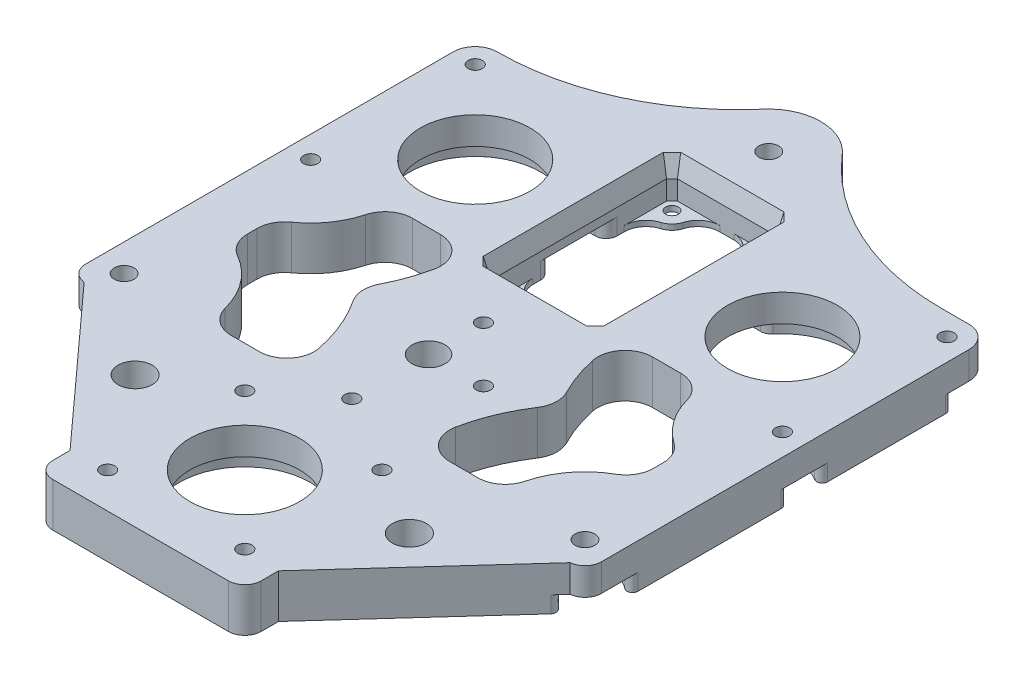
from build123d import *

# Parameters (mm, degrees)
BOSS_EXTRUDE1_DEPTH                             = 5
FILLET1_R                                       = 4
SKETCH22_W                                      = 28
SKETCH22_H                                      = 5
CUT_EXTRUDE3_DEPTH                              = 34
CSK_FOR_M3_FLAT_HEAD_MACHINE_SCREW1_D           = 3.6
CSK_FOR_M3_FLAT_HEAD_MACHINE_SCREW1_CSINK_D     = 6.3
CSK_FOR_M3_FLAT_HEAD_MACHINE_SCREW1_CSINK_ANGLE = 90
FILLET4_R                                       = 3
CHAMFER3_DEPTH                                  = 5
CSK_FOR_M2_FLAT_HEAD_MACHINE_SCREW2_D           = 2.6
CSK_FOR_M2_FLAT_HEAD_MACHINE_SCREW2_CSINK_D     = 4.4
CSK_FOR_M2_FLAT_HEAD_MACHINE_SCREW2_CSINK_ANGLE = 90
CUT_EXTRUDE4_DEPTH                              = 87.546230421
CUT_EXTRUDE4_DEPTH_BACK                         = 87.546230421
SKETCH25_R                                      = 1.3
SKETCH25_R_2                                    = 3
CHAMFER1_SIZE                                   = 0.9
SKETCH27_R                                      = 10
CUT_EXTRUDE9_DEPTH                              = 10
SKETCH29_R                                      = 3.1
CUT_EXTRUDE11_DEPTH                             = 87.546230421
SKETCH33_R                                      = 2.395679076
CUT_EXTRUDE14_DEPTH                             = 10
CUT_EXTRUDE15_DEPTH                             = 10
BOSS_EXTRUDE2_START                             = 3
SKETCH36_R                                      = 5.15
SKETCH36_R_2                                    = 12
SKETCH36_R_3                                    = 4.2
SKETCH36_R_4                                    = 3
SKETCH36_R_5                                    = 5.1
SKETCH36_R_6                                    = 2.2
BOSS_EXTRUDE2_DEPTH                             = 3
SKETCH37_R                                      = 1.15
BOSS_EXTRUDE3_DEPTH                             = 1
FILLET5_R                                       = 44
FILLET6_R                                       = 4
SKETCH39_R                                      = 4.2
CUT_EXTRUDE16_DEPTH                             = 3
FILLET7_START                                   = -4
FILLET7_DEPTH                                   = 4
CUT_EXTRUDE17_DEPTH                             = 87.771250999
SKETCH41_W                                      = 13.805283352
SKETCH41_H                                      = 10
CUT_EXTRUDE18_DEPTH                             = 3
FILLET8_R                                       = 5
FILLET9_R                                       = 2
CHAMFER5_SIZE                                   = 1
CHAMFER5_SIZE2                                  = 3.487414444


with BuildPart() as part:
    # Sketch1 → Boss-Extrude1 (new body)
    with BuildSketch(Plane(origin=(0, 0, 0), x_dir=(1, 0, 0), z_dir=(0, 1, 0))):
        with BuildLine():
            Line((47, -54), (-47, -54))
            Line((-47, -54), (-47, 54))
            Line((-47, 54), (-5.541381265, 54))
            ThreePointArc((-5.541381265, 54), (-2.5, 72.5), (0.541381265, 54))
            Line((0.541381265, 54), (10.891256717, 54))
            Line((10.891256717, 54), (47, 54))
            Line((47, 54), (47, -54))
        make_face()
    extrude(amount=BOSS_EXTRUDE1_DEPTH)

    # Fillet1
    fillet1_edges = [part.edges().sort_by_distance(p)[0] for p in [
        (47, 2.5, 54),
        (-47, 2.5, 54),
        (-47, 2.5, -54),
        (47, 2.5, -54),
    ]]
    fillet(fillet1_edges, radius=FILLET1_R)

    # Sketch22 → Cut-Extrude3 (cut)
    with BuildSketch(Plane.XY.offset(54)):
        with Locations((-33, 2.5)):
            Rectangle(SKETCH22_W, SKETCH22_H)
        with Locations((33, 2.5)):
            Rectangle(SKETCH22_W, SKETCH22_H)
    extrude(amount=-CUT_EXTRUDE3_DEPTH, mode=Mode.SUBTRACT)

    # CSK for M3 Flat Head Machine Screw1 (through all)
    with Locations(Plane(origin=(0, 0, 0), x_dir=(-1, 0, 0), z_dir=(0, -1, 0))):
        with Locations((-42, -49), (2.5, 63), (42, -49), (-42, -15), (42, -15)):
            CounterSinkHole(CSK_FOR_M3_FLAT_HEAD_MACHINE_SCREW1_D / 2, CSK_FOR_M3_FLAT_HEAD_MACHINE_SCREW1_CSINK_D / 2, counter_sink_angle=CSK_FOR_M3_FLAT_HEAD_MACHINE_SCREW1_CSINK_ANGLE)

    # Fillet4
    fillet4_edges = [part.edges().sort_by_distance(p)[0] for p in [
        (-47, 2.5, 20),
        (-19, 2.5, 54),
        (47, 2.5, 20),
        (19, 2.5, 54),
    ]]
    fillet(fillet4_edges, radius=FILLET4_R)

    # Chamfer3: read off the stored shape, not the designer's step
    # Chamfer3 outline → Chamfer3 (add)
    with BuildSketch(Plane(origin=(0, 0, 0), x_dir=(1, 0, 0), z_dir=(0, 1, 0))):
        with BuildLine():
            Line((19, -20), (19, -47.854497241))
            Line((19, -47.854497241), (44.290322581, -19.985919088))
            ThreePointArc((44.290322581, -19.985919088), (44.145331925, -19.996477704), (44, -20))
            Line((44, -20), (19, -20))
        make_face()
        with BuildLine():
            ThreePointArc((-44, -20), (-44.145331925, -19.996477704), (-44.290322581, -19.985919088))
            Line((-44.290322581, -19.985919088), (-19, -47.854497241))
            Line((-19, -47.854497241), (-19, -20))
            Line((-19, -20), (-44, -20))
        make_face()
    extrude(amount=CHAMFER3_DEPTH)

    # CSK for M2 Flat Head Machine Screw2 (through all)
    with Locations(Plane(origin=(0, 0, 0), x_dir=(-1, 0, 0), z_dir=(0, -1, 0))):
        with Locations((12.5, -47.5), (-12.5, -47.5), (12.5, -22.5), (-12.5, -22.5), (-43, 50), (-43, 20), (43, 50), (43, 20)):
            CounterSinkHole(CSK_FOR_M2_FLAT_HEAD_MACHINE_SCREW2_D / 2, CSK_FOR_M2_FLAT_HEAD_MACHINE_SCREW2_CSINK_D / 2, counter_sink_angle=CSK_FOR_M2_FLAT_HEAD_MACHINE_SCREW2_CSINK_ANGLE)

    # Sketch25 → Cut-Extrude4 (cut, two sides: drawn at the far end of the back side and taken through both)
    with BuildSketch(Plane(origin=(0, 0, 0), x_dir=(1, 0, 0), z_dir=(0, 1, 0)).offset(-CUT_EXTRUDE4_DEPTH_BACK)):
        with Locations(Location((-1.5, 10, 0), (0, 0, 270))):
            Circle(SKETCH25_R)
        with Locations(Location((8.5, 0, 0), (0, 0, 270))):
            Circle(SKETCH25_R)
        with Locations(Location((-1.5, -14, 0), (0, 0, 270))):
            Circle(SKETCH25_R)
        with Locations(Location((-1.5, 0, 0), (0, 0, 270))):
            Circle(SKETCH25_R_2)
    extrude(amount=CUT_EXTRUDE4_DEPTH + CUT_EXTRUDE4_DEPTH_BACK, mode=Mode.SUBTRACT)

    # Chamfer1
    chamfer1_edges = [part.edges().sort_by_distance(p)[0] for p in [
        (-1.5, 0, -11.3),
        (8.5, 0, -1.3),
        (-1.5, 0, 12.7),
    ]]
    chamfer(chamfer1_edges, length=CHAMFER1_SIZE)

    # Sketch27 → Cut-Extrude9 (cut)
    with BuildSketch(Plane(origin=(0, 5, 0), x_dir=(1, 0, 0), z_dir=(0, 1, 0))):
        with Locations(Location((-28, 35, 0), (0, 0, 270))):
            Circle(SKETCH27_R)
        with Locations(Location((28, 35, 0), (0, 0, 270))):
            Circle(SKETCH27_R)
        with Locations(Location((0, -35, 0), (0, 0, 270))):
            Circle(SKETCH27_R)
    extrude(amount=-CUT_EXTRUDE9_DEPTH, mode=Mode.SUBTRACT)

    # Sketch29 → Cut-Extrude11 (cut, through all)
    with BuildSketch(Plane(origin=(0, 5, 0), x_dir=(1, 0, 0), z_dir=(0, 1, 0))):
        with Locations(Location((-25, -30, 0), (0, 0, 270))):
            Circle(SKETCH29_R)
        with Locations(Location((25, -30, 0), (0, 0, 270))):
            Circle(SKETCH29_R)
    extrude(amount=-CUT_EXTRUDE11_DEPTH, mode=Mode.SUBTRACT)

    # Sketch33 → Cut-Extrude14 (cut)
    with BuildSketch(Plane(origin=(0, 5, 0), x_dir=(1, 0, 0), z_dir=(0, 1, 0))):
        with Locations(Location((-1, 44.371040497, 0), (0, 0, 270))):
            Circle(SKETCH33_R)
    extrude(amount=-CUT_EXTRUDE14_DEPTH, mode=Mode.SUBTRACT)

    # Sketch34 → Cut-Extrude15 (cut)
    with BuildSketch(Plane(origin=(0, 5, 0), x_dir=(1, 0, 0), z_dir=(0, 1, 0))):
        Polygon((8.999676238, 20.872191652), (7.999676238, 19.872191652), (-9.999676238, 19.872191652), (-10.999676238, 20.872191652), (-10.999676238, 52.871040497), (-9.999676238, 53.871040497), (7.999676238, 53.871040497), (8.999676238, 52.871040497), align=None)
    extrude(amount=-CUT_EXTRUDE15_DEPTH, mode=Mode.SUBTRACT)

    # Sketch36 → Boss-Extrude2 (add)
    with BuildSketch(Plane.XZ.offset(BOSS_EXTRUDE2_START)):
        with BuildLine():
            ThreePointArc((47, 13.766103732), (37.729002445, 12.122313449), (42.734134015, 20.097405933))
            Line((42.734134015, 20.097405933), (44.290322581, 19.985919088))
            Line((44.290322581, 19.985919088), (19, 47.854497241))
            Line((19, 47.854497241), (19, 51))
            ThreePointArc((19, 51), (18.121320344, 53.121320344), (16, 54))
            Line((16, 54), (-16, 54))
            ThreePointArc((-16, 54), (-18.121320344, 53.121320344), (-19, 51))
            Line((-19, 51), (-19, 47.854497241))
            Line((-19, 47.854497241), (-44.290322581, 19.985919088))
            Line((-44.290322581, 19.985919088), (-42.734134015, 20.097405933))
            ThreePointArc((-42.734134015, 20.097405933), (-37.729002445, 12.122313449), (-47, 13.766103732))
            Line((-47, 13.766103732), (-47, -18.719375153))
            ThreePointArc((-47, -18.719375153), (-38.8, -20), (-47, -21.280624847))
            Line((-47, -21.280624847), (-47, -48.719375153))
            ThreePointArc((-47, -48.719375153), (-40.030151519, -47.030151519), (-41.719375153, -54))
            Line((-41.719375153, -54), (-5.541381265, -54))
            ThreePointArc((-5.541381265, -54), (-2.5, -72.5), (0.541381265, -54))
            Line((0.541381265, -54), (41.719375153, -54))
            Line((41.719375153, -54), (43, -54))
            ThreePointArc((43, -54), (45.828427125, -52.828427125), (47, -50))
            Line((47, -50), (47, -21.280624847))
            ThreePointArc((47, -21.280624847), (38.8, -20), (47, -18.719375153))
            Line((47, -18.719375153), (47, 13.766103732))
        make_face()
        with Locations(Location((-2.5, -63, 0), (0, 0, 270))):
            Circle(SKETCH36_R, mode=Mode.SUBTRACT)
        with Locations(Location((-28, -35, 0), (0, 0, 270))):
            Circle(SKETCH36_R_2, mode=Mode.SUBTRACT)
        Polygon((8.999676238, -52.871040497), (7.999676238, -53.871040497), (-9.999676238, -53.871040497), (-10.999676238, -52.871040497), (-10.999676238, -20.872191652), (-9.999676238, -19.872191652), (7.999676238, -19.872191652), (8.999676238, -20.872191652), align=None, mode=Mode.SUBTRACT)
        with Locations(Location((-1.5, -10, 0), (0, 0, 270))):
            Circle(SKETCH36_R_3, mode=Mode.SUBTRACT)
        with Locations(Location((28, -35, 0), (0, 0, 270))):
            Circle(SKETCH36_R_2, mode=Mode.SUBTRACT)
        with Locations(Location((-1.5, 0, 0), (0, 0, 90))):
            Circle(SKETCH36_R_4, mode=Mode.SUBTRACT)
        with Locations(Location((-1.5, 14, 0), (0, 0, 270))):
            Circle(SKETCH36_R_3, mode=Mode.SUBTRACT)
        with Locations(Location((-25, 30, 0), (0, 0, 270))):
            Circle(SKETCH36_R_5, mode=Mode.SUBTRACT)
        with Locations(Location((-12.5, 22.5, 0), (0, 0, 270))):
            Circle(SKETCH36_R_3, mode=Mode.SUBTRACT)
        with Locations(Location((-12.5, 47.5, 0), (0, 0, 270))):
            Circle(SKETCH36_R_3, mode=Mode.SUBTRACT)
        with Locations(Location((8.5, 0, 0), (0, 0, 270))):
            Circle(SKETCH36_R_3, mode=Mode.SUBTRACT)
        with Locations(Location((0, 35, 0), (0, 0, 270))):
            Circle(SKETCH36_R_2, mode=Mode.SUBTRACT)
        with Locations(Location((12.5, 22.5, 0), (0, 0, 270))):
            Circle(SKETCH36_R_3, mode=Mode.SUBTRACT)
        with Locations(Location((12.5, 47.5, 0), (0, 0, 270))):
            Circle(SKETCH36_R_3, mode=Mode.SUBTRACT)
        with Locations(Location((25, 30, 0), (0, 0, 270))):
            Circle(SKETCH36_R_5, mode=Mode.SUBTRACT)
        with Locations(Location((43, -50, 0), (0, 0, 270))):
            Circle(SKETCH36_R_6, mode=Mode.SUBTRACT)
    extrude(amount=-BOSS_EXTRUDE2_DEPTH)

    # Sketch37 → Boss-Extrude3 (add)
    # profile 1 of 4: a face of its own
    with BuildSketch(Plane.XZ.offset(3)):
        with BuildLine():
            ThreePointArc((-10.999676238, -24.106837986), (-6.879337603, -23.992458554), (-6.762402671, -19.872191652))
            Line((-6.762402671, -19.872191652), (-9.999676238, -19.872191652))
            Line((-9.999676238, -19.872191652), (-10.999676238, -20.872191652))
            Line((-10.999676238, -20.872191652), (-10.999676238, -24.106837986))
        make_face()
        with Locations(Location((-9, -21.870480469, 0), (0, 0, 270))):
            Circle(SKETCH37_R, mode=Mode.SUBTRACT)
    # profile 2 of 4: a face of its own
    with BuildSketch(Plane.XZ.offset(3)):
        with BuildLine():
            ThreePointArc((4.762402671, -19.872191652), (4.879337603, -23.992458554), (8.999676238, -24.106837986))
            Line((8.999676238, -24.106837986), (8.999676238, -20.872191652))
            Line((8.999676238, -20.872191652), (7.999676238, -19.872191652))
            Line((7.999676238, -19.872191652), (4.762402671, -19.872191652))
        make_face()
        with Locations(Location((7, -21.870480469, 0), (0, 0, 270))):
            Circle(SKETCH37_R, mode=Mode.SUBTRACT)
    # profile 3 of 4: a face of its own
    with BuildSketch(Plane.XZ.offset(3)):
        with BuildLine():
            Line((8.999676238, -49.634122952), (8.999676238, -52.871040497))
            Line((8.999676238, -52.871040497), (7.999676238, -53.871040497))
            Line((7.999676238, -53.871040497), (4.764433053, -53.871040497))
            ThreePointArc((4.764433053, -53.871040497), (4.878260459, -49.749579405), (8.999676238, -49.634122952))
        make_face()
        with Locations(Location((7, -51.870480469, 0), (0, 0, 270))):
            Circle(SKETCH37_R, mode=Mode.SUBTRACT)
    # profile 4 of 4: a face of its own
    with BuildSketch(Plane.XZ.offset(3)):
        with BuildLine():
            Line((-6.764433053, -53.871040497), (-9.999676238, -53.871040497))
            Line((-9.999676238, -53.871040497), (-10.999676238, -52.871040497))
            Line((-10.999676238, -52.871040497), (-10.999676238, -49.634122952))
            ThreePointArc((-10.999676238, -49.634122952), (-6.878260459, -49.749579405), (-6.764433053, -53.871040497))
        make_face()
        with Locations(Location((-9, -51.870480469, 0), (0, 0, 270))):
            Circle(SKETCH37_R, mode=Mode.SUBTRACT)
    extrude(amount=-BOSS_EXTRUDE3_DEPTH)

    # Fillet5
    fillet5_edges = [part.edges().sort_by_distance(p)[0] for p in [
        (0.541381265, 1, -54),
        (-5.541381265, 1, -54),
    ]]
    fillet(fillet5_edges, radius=FILLET5_R)

    # Fillet6
    fillet6_edges = [part.edges().sort_by_distance(p)[0] for p in [
        (-10.999676238, -2.5, -24.106837986),
        (-6.762402671, -2.5, -19.872191652),
        (4.762402671, -2.5, -19.872191652),
        (8.999676238, -2.5, -24.106837986),
        (8.999676238, -2.5, -49.634122952),
        (4.764433053, -2.5, -53.871040497),
        (-6.764433053, -2.5, -53.871040497),
        (-10.999676238, -2.5, -49.634122952),
    ]]
    fillet(fillet6_edges, radius=FILLET6_R)

    # Sketch39 → Cut-Extrude16 (cut)
    with BuildSketch(Plane.XZ.offset(3)):
        with Locations((43, -50)):
            Circle(SKETCH39_R)
    extrude(amount=-CUT_EXTRUDE16_DEPTH, mode=Mode.SUBTRACT)

    # Fillet7: read off the stored shape, not the designer's step
    # Fillet7 outline → Fillet7 (cut)
    with BuildSketch(Plane(origin=(0, 0, 0), x_dir=(1, 0, 0), z_dir=(0, 1, 0)).offset(FILLET7_START)):
        with BuildLine():
            ThreePointArc((-42.625070447, -21.820937565), (-42.802636287, -20.752561378), (-41.903312992, -20.149092311))
            ThreePointArc((-41.903312992, -20.149092311), (-42.319769514, -20.140062982), (-42.734134015, -20.097405933))
            Line((-42.734134015, -20.097405933), (-44.290322581, -19.985919088))
            Line((-44.290322581, -19.985919088), (-42.625070447, -21.820937565))
        make_face()
        with BuildLine():
            ThreePointArc((-45.349593496, -11.088130445), (-46.41808701, -11.23695111), (-47, -10.328544124))
            Line((-47, -10.328544124), (-47, -13.766103732))
            ThreePointArc((-47, -13.766103732), (-46.384268824, -12.298021672), (-45.349593496, -11.088130445))
        make_face()
        with BuildLine():
            ThreePointArc((-41.770956351, 54.016148865), (-40.613598394, 53.456166572), (-39.679871918, 52.572304321))
            ThreePointArc((-39.679871918, 52.572304321), (-39.80628908, 53.583819955), (-38.979889249, 54.180652004))
            ThreePointArc((-38.979889249, 54.180652004), (-40.374115833, 54.076225591), (-41.770956351, 54.016148865))
        make_face()
        with BuildLine():
            Line((-47, 48.719375153), (-47, 45.752647884))
            ThreePointArc((-47, 45.752647884), (-46.459933105, 46.640601451), (-45.423076923, 46.569446368))
            ThreePointArc((-45.423076923, 46.569446368), (-46.386669121, 47.515956469), (-47, 48.719375153))
        make_face()
        with BuildLine():
            ThreePointArc((-45.423076923, 23.430553632), (-46.459933105, 23.359398549), (-47, 24.247352116))
            Line((-47, 24.247352116), (-47, 21.280624847))
            ThreePointArc((-47, 21.280624847), (-46.386669121, 22.484043531), (-45.423076923, 23.430553632))
        make_face()
        with BuildLine():
            ThreePointArc((-47, 15.752647884), (-46.459933105, 16.640601451), (-45.423076923, 16.569446368))
            ThreePointArc((-45.423076923, 16.569446368), (-46.386669121, 17.515956469), (-47, 18.719375153))
            Line((-47, 18.719375153), (-47, 15.752647884))
        make_face()
        with BuildLine():
            Line((41.719375153, 54), (38.752647884, 54))
            ThreePointArc((38.752647884, 54), (39.640601451, 53.459933105), (39.569446368, 52.423076923))
            ThreePointArc((39.569446368, 52.423076923), (40.515956469, 53.386669121), (41.719375153, 54))
        make_face()
        with BuildLine():
            ThreePointArc((42.734134015, -20.097405933), (42.319769514, -20.140062982), (41.903312992, -20.14909231))
            ThreePointArc((41.903312992, -20.14909231), (42.802636287, -20.752561378), (42.625070447, -21.820937565))
            Line((42.625070447, -21.820937565), (44.290322581, -19.985919088))
            Line((44.290322581, -19.985919088), (42.734134015, -20.097405933))
        make_face()
        with BuildLine():
            Line((47, -13.766103732), (47, -10.328544124))
            ThreePointArc((47, -10.328544124), (46.41808701, -11.23695111), (45.349593496, -11.088130445))
            ThreePointArc((45.349593496, -11.088130445), (46.384268824, -12.298021672), (47, -13.766103732))
        make_face()
        with BuildLine():
            Line((47, 21.280624847), (47, 24.247352116))
            ThreePointArc((47, 24.247352116), (46.459933105, 23.359398549), (45.423076923, 23.430553632))
            ThreePointArc((45.423076923, 23.430553632), (46.386669121, 22.484043531), (47, 21.280624847))
        make_face()
        with BuildLine():
            ThreePointArc((47, 48.719375153), (46.386669121, 47.515956469), (45.423076923, 46.569446368))
            ThreePointArc((45.423076923, 46.569446368), (46.459933105, 46.640601451), (47, 45.752647884))
            Line((47, 45.752647884), (47, 48.719375153))
        make_face()
        with BuildLine():
            ThreePointArc((47, 18.719375153), (46.386669121, 17.515956469), (45.423076923, 16.569446368))
            ThreePointArc((45.423076923, 16.569446368), (46.459933105, 16.640601451), (47, 15.752647884))
            Line((47, 15.752647884), (47, 18.719375153))
        make_face()
    extrude(amount=FILLET7_DEPTH, mode=Mode.SUBTRACT)

    # Sketch40 → Cut-Extrude17 (cut, through all)
    with BuildSketch(Plane.XZ.offset(3)):
        with BuildLine():
            ThreePointArc((-13.8, -20), (-15.020790346, -11.645131532), (-18.581084049, -3.988861884))
            ThreePointArc((-18.581084049, -3.988861884), (-13.582550995, 4.926713941), (-11.85, 15))
            Line((-11.85, 15), (-26.85, 15))
            ThreePointArc((-26.85, 15), (-29.645395595, 6.231519516), (-37, 0.698863682))
            Line((-37, 0.698863682), (-37, -7.129879565))
            ThreePointArc((-37, -7.129879565), (-31.02419105, -12.369796857), (-28.8, -20))
            Line((-28.8, -20), (-13.8, -20))
        make_face()
        with BuildLine():
            ThreePointArc((11.85, 15), (13.582550995, 4.926713941), (18.581084049, -3.988861884))
            ThreePointArc((18.581084049, -3.988861884), (15.020790346, -11.645131532), (13.8, -20))
            Line((13.8, -20), (28.8, -20))
            ThreePointArc((28.8, -20), (31.02419105, -12.369796857), (37, -7.129879565))
            Line((37, -7.129879565), (37, 0.698863682))
            ThreePointArc((37, 0.698863682), (29.645395595, 6.231519516), (26.85, 15))
            Line((26.85, 15), (11.85, 15))
        make_face()
    extrude(amount=-CUT_EXTRUDE17_DEPTH, mode=Mode.SUBTRACT)

    # Sketch41 → Cut-Extrude18 (cut)
    with BuildSketch(Plane.XZ.offset(3)):
        with Locations((15.902317914, -36.870480469)):
            Rectangle(SKETCH41_W, SKETCH41_H)
        with Locations((-17.902317914, -36.870480469)):
            Rectangle(SKETCH41_W, SKETCH41_H)
    extrude(amount=-CUT_EXTRUDE18_DEPTH, mode=Mode.SUBTRACT)

    # Fillet8
    fillet8_edges = [part.edges().sort_by_distance(p)[0] for p in [
        (-18.581084049, 1, -3.988861884),
        (-13.8, 1, -20),
        (-28.8, 1, -20),
        (-37, 1, -7.129879565),
        (-37, 1, 0.698863682),
        (-26.85, 1, 15),
        (-11.85, 1, 15),
        (18.581084049, 1, -3.988861884),
        (11.85, 1, 15),
        (26.85, 1, 15),
        (37, 1, 0.698863682),
        (37, 1, -7.129879565),
        (28.8, 1, -20),
        (13.8, 1, -20),
    ]]
    fillet(fillet8_edges, radius=FILLET8_R)

    # Fillet9
    fillet9_edges = [part.edges().sort_by_distance(p)[0] for p in [
        (18.161478865, -1.5, -41.870480469),
        (16.41526403, -1.5, -31.870480469),
        (8.999676238, -1.5, -31.870480469),
        (8.999676238, -1.5, -41.870480469),
        (-16.41526403, -1.5, -31.870480469),
        (-18.161478865, -1.5, -41.870480469),
        (-10.999676238, -1.5, -41.870480469),
        (-10.999676238, -1.5, -31.870480469),
    ]]
    fillet(fillet9_edges, radius=FILLET9_R)

    # Chamfer5
    chamfer5_edges = [part.edges().sort_by_distance(p)[0] for p in [
        (8.999676238, 5, -36.871616075),
        (8.499676238, 5, -53.371040497),
        (-1, 5, -53.871040497),
        (-10.499676238, 5, -53.371040497),
        (-10.999676238, 5, -36.871616075),
        (-10.499676238, 5, -20.372191652),
        (-1, 5, -19.872191652),
        (8.499676238, 5, -20.372191652),
    ]]
    chamfer5_side = [part.faces().sort_by_distance(p)[0] for p in [
        (-0.105039744, 5, -7.06620626),
    ]]
    chamfer(chamfer5_edges, length=CHAMFER5_SIZE, length2=CHAMFER5_SIZE2, reference=chamfer5_side[0])


solid = part.part
